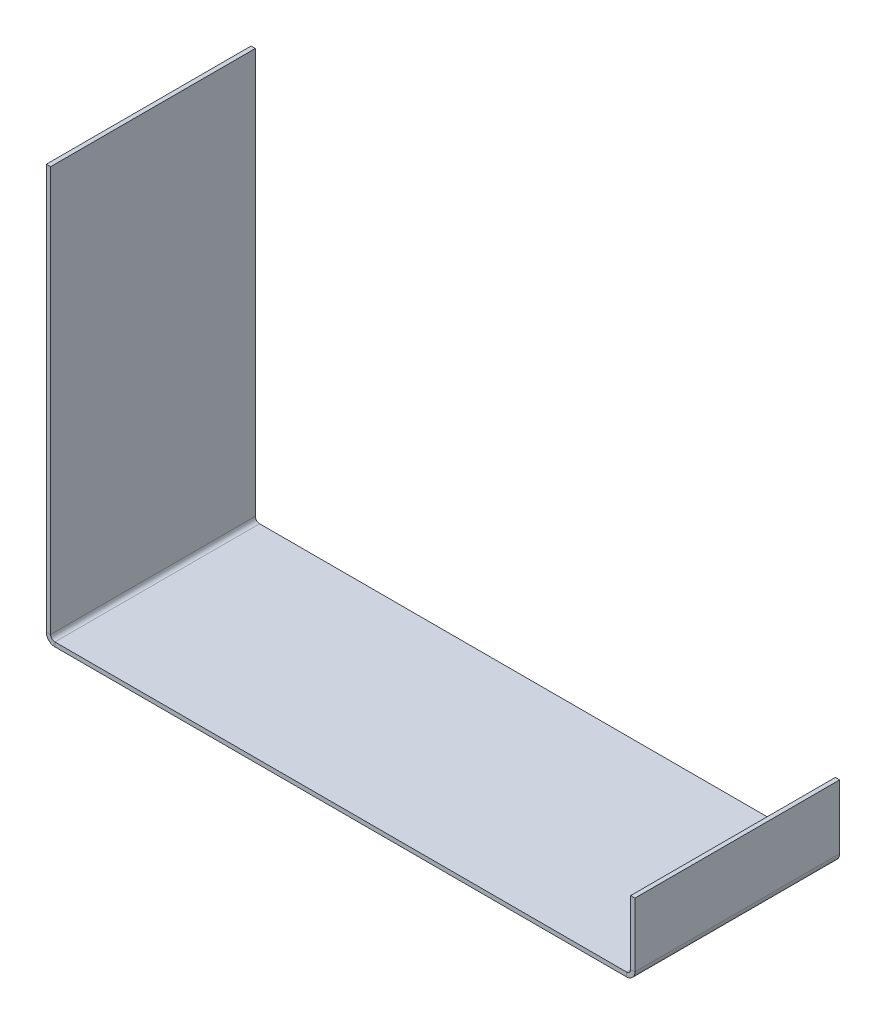
from build123d import *

# Parameters (mm, degrees)
SKETCH1_W                    = 215.9
SKETCH1_H                    = 76.2
BASE_FLANGE1_DEPTH           = 1.5875
EDGE_FLANGE1_STRIP_W         = 9.525
EDGE_FLANGE1_STRIP_H         = 1.5875
EDGE_FLANGE1_STRIP_CUT_DEPTH = 76.2
EDGE_FLANGE1_DEPTH           = 76.2
EDGE_FLANGE3_STRIP_W         = 9.525
EDGE_FLANGE3_STRIP_H         = 1.5875
EDGE_FLANGE3_STRIP_CUT_DEPTH = 76.2
EDGE_FLANGE3_DEPTH           = 76.2


# Sheet-metal steps are written as plain solids
with BuildPart() as part:
    # Sketch1 → Base-Flange1 (new body)
    with BuildSketch(Plane(origin=(0, 0, 0), x_dir=(1, 0, 0), z_dir=(0, 1, 0))):
        Rectangle(SKETCH1_W, SKETCH1_H)
    extrude(amount=-BASE_FLANGE1_DEPTH)

    # Edge-Flange1 strip (across the edge) → Edge-Flange1 strip cut (cut)
    with BuildSketch(Plane(origin=(-107.95, 0, -38.1), x_dir=(1, 0, 0), z_dir=(0, 0, 1))):
        with Locations((-3.175, -0.79375)):
            Rectangle(EDGE_FLANGE1_STRIP_W, EDGE_FLANGE1_STRIP_H)
    extrude(amount=EDGE_FLANGE1_STRIP_CUT_DEPTH, mode=Mode.SUBTRACT)

    # Edge-Flange1 section (across the edge) → Edge-Flange1 (add)
    with BuildSketch(Plane(origin=(-107.95, 0, -38.1), x_dir=(1, 0, 0), z_dir=(0, 0, 1))):
        with BuildLine():
            Line((-1.5875, 1.5875), (-1.5875, 152.4))
            Line((-1.5875, 152.4), (0, 152.4))
            Line((0, 152.4), (0, 1.5875))
            ThreePointArc((0, 1.5875), (0.464967985, 0.464967985), (1.5875, 0))
            Line((1.5875, 0), (1.5875, -1.5875))
            ThreePointArc((1.5875, -1.5875), (-0.65756403, -0.65756403), (-1.5875, 1.5875))
        make_face()
    extrude(amount=EDGE_FLANGE1_DEPTH)

    # Edge-Flange3 strip (across the edge) → Edge-Flange3 strip cut (cut)
    with BuildSketch(Plane(origin=(107.95, 0, 38.1), x_dir=(-1, 0, 0), z_dir=(0, 0, -1))):
        with Locations((-3.175, -0.79375)):
            Rectangle(EDGE_FLANGE3_STRIP_W, EDGE_FLANGE3_STRIP_H)
    extrude(amount=EDGE_FLANGE3_STRIP_CUT_DEPTH, mode=Mode.SUBTRACT)

    # Edge-Flange3 section (across the edge) → Edge-Flange3 (add)
    with BuildSketch(Plane(origin=(107.95, 0, 38.1), x_dir=(-1, 0, 0), z_dir=(0, 0, -1))):
        with BuildLine():
            Line((-1.5875, 1.5875), (-1.5875, 25.4))
            Line((-1.5875, 25.4), (0, 25.4))
            Line((0, 25.4), (0, 1.5875))
            ThreePointArc((0, 1.5875), (0.464967985, 0.464967985), (1.5875, 0))
            Line((1.5875, 0), (1.5875, -1.5875))
            ThreePointArc((1.5875, -1.5875), (-0.65756403, -0.65756403), (-1.5875, 1.5875))
        make_face()
    extrude(amount=EDGE_FLANGE3_DEPTH)


solid = part.part
